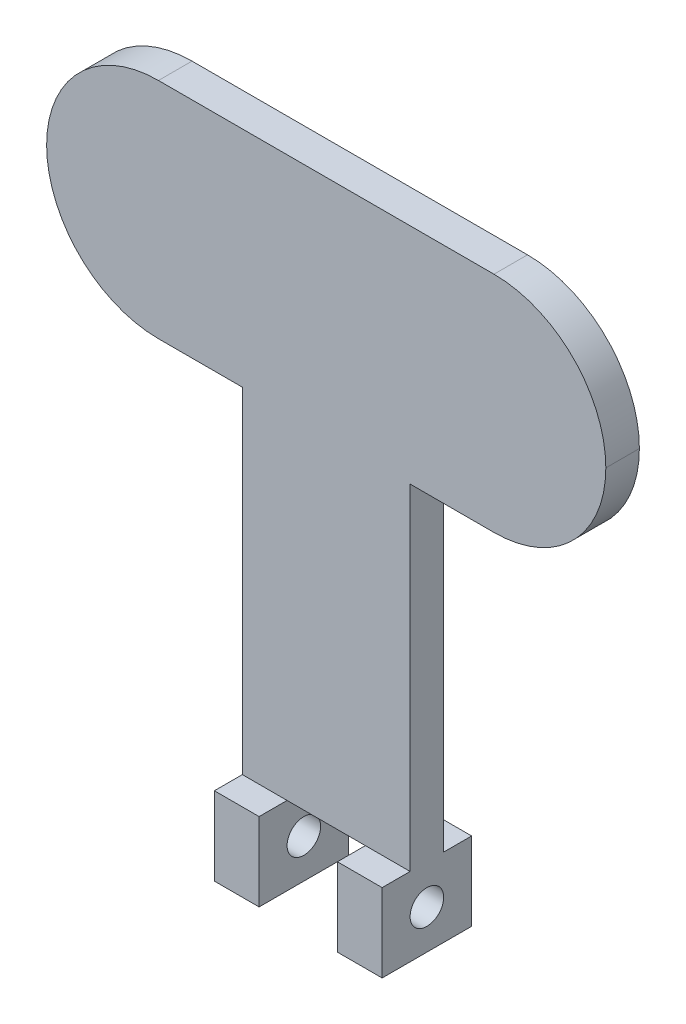
from build123d import *

# Parameters (mm, degrees)
SKETCH_1_W          = 50
SKETCH_1_H          = 20
EXTRUDE_1_DEPTH     = 3
FILLET_1_R          = 10
FILLET_2_R          = 10
FILLET_3_R          = 10
FILLET_4_R          = 10
SKETCH_2_W          = 15
SKETCH_2_H          = 30
EXTRUDE_2_DEPTH     = 3
SKETCH_4_W          = 4
SKETCH_4_H          = 8
EXTRUDE_4_DEPTH     = 7
SKETCH_5_R          = 1.5
CUT_EXTRUDE_1_DEPTH = 58.406445631


with BuildPart() as part:
    # 草图1 → 凸台-拉伸1 (new body)
    with BuildSketch(Plane.XY):
        Rectangle(SKETCH_1_W, SKETCH_1_H)
    extrude(amount=EXTRUDE_1_DEPTH)

    # 圆角1
    fillet_1_edges = [part.edges().sort_by_distance(p)[0] for p in [
        (25, 10, 1.5),
    ]]
    fillet(fillet_1_edges, radius=FILLET_1_R)

    # 圆角2
    fillet_2_edges = [part.edges().sort_by_distance(p)[0] for p in [
        (-25, 10, 1.5),
    ]]
    fillet(fillet_2_edges, radius=FILLET_2_R)

    # 圆角3
    fillet_3_edges = [part.edges().sort_by_distance(p)[0] for p in [
        (25, -10, 1.5),
    ]]
    fillet(fillet_3_edges, radius=FILLET_3_R - 0.0001)  # a hair under: the kernel refuses the full size

    # 圆角4
    fillet_4_edges = [part.edges().sort_by_distance(p)[0] for p in [
        (-25, -10, 1.5),
    ]]
    fillet(fillet_4_edges, radius=FILLET_4_R - 0.0001)  # a hair under: the kernel refuses the full size

    # 草图2 → 凸台-拉伸2 (add)
    with BuildSketch(Plane(origin=(0, 0, 0), x_dir=(-1, 0, 0), z_dir=(0, 0, -1))):
        with Locations((0, -25)):
            Rectangle(SKETCH_2_W, SKETCH_2_H)
    extrude(amount=-EXTRUDE_2_DEPTH)

    # 草图4 → 凸台-拉伸4 (add)
    with BuildSketch(Plane(origin=(0, -40, 0), x_dir=(-1, 0, 0), z_dir=(0, -1, 0))):
        with Locations((-5.5, -1.5)):
            Rectangle(SKETCH_4_W, SKETCH_4_H)
        with Locations((5.5, -1.5)):
            Rectangle(SKETCH_4_W, SKETCH_4_H)
    extrude(amount=EXTRUDE_4_DEPTH)

    # 草图5 → 切除-拉伸1 (cut, through all)
    with BuildSketch(Plane(origin=(7.5, 0, 0), x_dir=(0, 0, -1), z_dir=(1, 0, 0))):
        with Locations(Location((-1.5, -43.5, 0), (0, 0, 180))):
            Circle(SKETCH_5_R)
    extrude(amount=-CUT_EXTRUDE_1_DEPTH, mode=Mode.SUBTRACT)


solid = part.part
